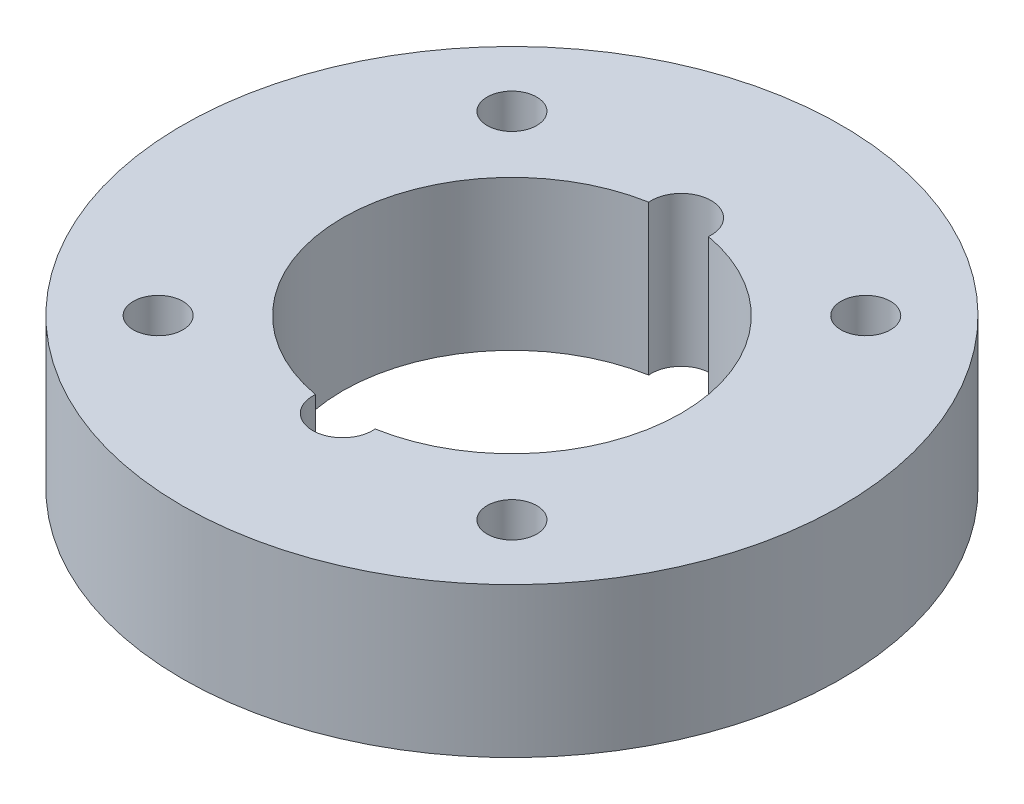
from build123d import *

# Parameters (mm, degrees)
F_0_5IN_SOCKET_R    = 27.94
F_0_5IN_SOCKET_R_2  = 2.1
BOSS_EXTRUDE1_DEPTH = 12.7


with BuildPart() as part:
    # 0.5in Socket → Boss-Extrude1 (new body)
    with BuildSketch(Plane(origin=(0, 0, 0), x_dir=(1, 0, 0), z_dir=(0, 1, 0))):
        Circle(F_0_5IN_SOCKET_R)
        with Locations((-14.997027722, -14.997027722)):
            Circle(F_0_5IN_SOCKET_R_2, mode=Mode.SUBTRACT)
        with Locations((14.997027722, -14.997027722)):
            Circle(F_0_5IN_SOCKET_R_2, mode=Mode.SUBTRACT)
        with BuildLine():
            ThreePointArc((-2.530034488, -14.126221239), (-14.351, 0), (-2.530034488, 14.126221239))
            ThreePointArc((-2.530034488, 14.126221239), (0, 16.891), (2.530034488, 14.126221239))
            ThreePointArc((2.530034488, 14.126221239), (14.351, 0), (2.530034488, -14.126221239))
            ThreePointArc((2.530034488, -14.126221239), (0, -16.891), (-2.530034488, -14.126221239))
        make_face(mode=Mode.SUBTRACT)
        with Locations((-14.997027722, 14.997027722)):
            Circle(F_0_5IN_SOCKET_R_2, mode=Mode.SUBTRACT)
        with Locations((14.997027722, 14.997027722)):
            Circle(F_0_5IN_SOCKET_R_2, mode=Mode.SUBTRACT)
    extrude(amount=BOSS_EXTRUDE1_DEPTH)


solid = part.part
